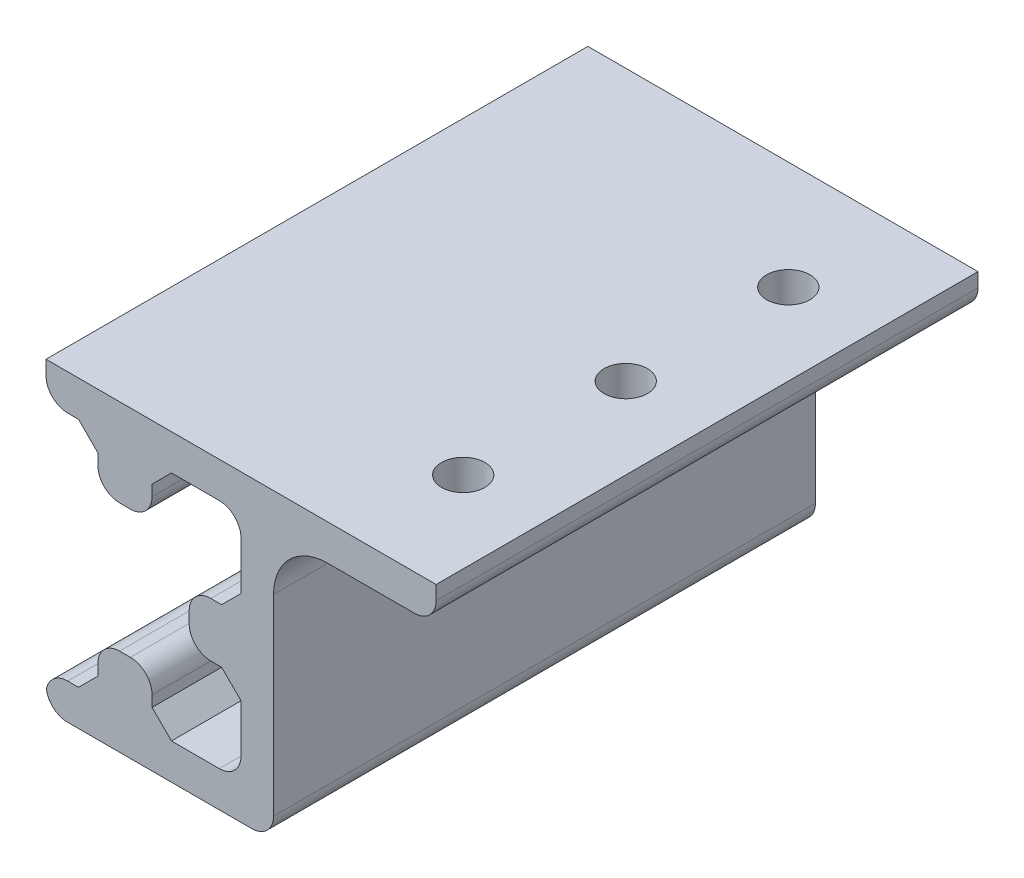
from build123d import *

# Parameters (mm, degrees)
BOSS_EXTRUDE1_DEPTH     = 50
CUT_EXTRUDE1_DEPTH      = 60.332090981
SKETCH3_W               = 15
SKETCH3_H               = 3.3
CUT_EXTRUDE2_DEPTH      = 60.332090981
CUT_EXTRUDE4_DEPTH      = 60.332090981
CUT_EXTRUDE4_DEPTH_BACK = 10
FILLET1_R               = 2
FILLET2_R               = 5
CUT_EXTRUDE5_DEPTH      = 60.332090981
CUT_EXTRUDE5_DEPTH_BACK = 60.332090981
SKETCH7_R               = 2
FILLET3_R               = 4


with BuildPart() as part:
    # Sketch1 → Boss-Extrude1 (new body)
    with BuildSketch(Plane.XY):
        Polygon((2.5, 7.92), (4.58, 10), (5.287106781, 10.707106781), (10.707106781, 10.707106781), (10.707106781, 5.287106781), (10, 4.58), (7.92, 2.5), (5.92, 2.5), (5.92, -2.5), (7.92, -2.5), (10, -4.58), (10.707106781, -5.287106781), (10.707106781, -7.287106781), (13.707106781, -7.287106781), (13.707106781, 10.707106781), (28.707106781, 10.707106781), (28.707106781, 14.007106781), (13.707106781, 14.007106781), (-7.287106781, 14.007106781), (-7.287106781, 10.707106781), (-5.287106781, 10.707106781), (-4.58, 10), (-2.5, 7.92), (-2.5, 5.92), (2.5, 5.92), align=None)
    boss_extrude1 = extrude(amount=BOSS_EXTRUDE1_DEPTH)

    # Sketch2 → Cut-Extrude1 (cut, through all)
    with BuildSketch(Plane.XY):
        Polygon((0, 0), (18.478629357, 0), (18.478629357, -9.938314006), (0, -9.42769987), align=None)
    extrude(amount=CUT_EXTRUDE1_DEPTH, mode=Mode.SUBTRACT)

    # Mirror1: Boss-Extrude1 across plane
    add(boss_extrude1.mirror(Plane.ZX))

    # Sketch3 → Cut-Extrude2 (cut, through all)
    with BuildSketch(Plane.XY):
        with Locations((21.207106781, -12.357106781)):
            Rectangle(SKETCH3_W, SKETCH3_H)
    extrude(amount=CUT_EXTRUDE2_DEPTH, mode=Mode.SUBTRACT)

    # Sketch6 → Cut-Extrude4 (cut, two sides: drawn at the far end of the back side and taken through both)
    with BuildSketch(Plane.XY.offset(-CUT_EXTRUDE4_DEPTH_BACK)):
        Polygon((-5.287106781, 10.707106781), (-4.287106781, 10.707106781), (-2.5, 8.92), (-2.5, 7.92), align=None)
        Polygon((2.5, 7.92), (2.5, 8.92), (4.287106781, 10.707106781), (5.287106781, 10.707106781), align=None)
        Polygon((7.92, 2.5), (8.92, 2.5), (10.707106781, 4.287106781), (10.707106781, 5.287106781), align=None)
        Polygon((7.92, -2.5), (10.707106781, -5.287106781), (10.707106781, -4.287106781), (8.92, -2.5), align=None)
        Polygon((2.5, -7.92), (5.287106781, -10.707106781), (4.287106781, -10.707106781), (2.5, -8.92), align=None)
        Polygon((-5.287106781, -10.707106781), (-2.5, -7.92), (-2.5, -8.92), (-4.287106781, -10.707106781), align=None)
    extrude(amount=CUT_EXTRUDE4_DEPTH + CUT_EXTRUDE4_DEPTH_BACK, mode=Mode.SUBTRACT)

    # Fillet1
    # the kernel refuses this fillet: 2 mm, written as the material it adds along each edge
    with BuildSketch(Plane(origin=(10.707106781, 10.707106781, 0), x_dir=(0, -1, 0), z_dir=(0, 0, 1)), Plane(origin=(10.707106781, -10.707106781, 0), x_dir=(-1, 0, 0), z_dir=(0, 0, 1))) as fillet1_piece_1:
        with BuildLine():
            CenterArc((FILLET1_R, -FILLET1_R), FILLET1_R, 90, 90)
            Line((0, -FILLET1_R), (0, 0))
            Line((0, 0), (FILLET1_R, 0))
        make_face()
    extrude(amount=50)
    # the kernel refuses this fillet: 2 mm, written as the material it takes off along each edge
    with BuildSketch(Plane(origin=(13.707106781, -14.007106781, -5), x_dir=(-1, 0, 0), z_dir=(0, 0, 1)), Plane(origin=(5.92, 2.5, -5), x_dir=(1, 0, 0), z_dir=(0, 0, 1)), Plane(origin=(2.5, 5.92, -5), x_dir=(-1, 0, 0), z_dir=(0, 0, 1)), Plane(origin=(-2.5, 5.92, -5), x_dir=(0, 1, 0), z_dir=(0, 0, 1)), Plane(origin=(-7.287106781, 10.707106781, -5), x_dir=(0, 1, 0), z_dir=(0, 0, 1)), Plane(origin=(28.707106781, 10.707106781, -5), x_dir=(-1, 0, 0), z_dir=(0, 0, 1)), Plane(origin=(5.92, -2.5, -5), x_dir=(0, 1, 0), z_dir=(0, 0, 1)), Plane(origin=(2.5, -5.92, -5), x_dir=(0, -1, 0), z_dir=(0, 0, 1)), Plane(origin=(-2.5, -5.92, -5), x_dir=(1, 0, 0), z_dir=(0, 0, 1)), Plane(origin=(-7.287106781, -10.707106781, -5), x_dir=(1, 0, 0), z_dir=(0, 0, 1)), Plane(origin=(-7.287106781, -14.007106781, -5), x_dir=(0, 1, 0), z_dir=(0, 0, 1))) as fillet1_2_piece_1:
        with BuildLine():
            CenterArc((FILLET1_R, -FILLET1_R), FILLET1_R, 90, 90)
            Line((0, -FILLET1_R), (0, 0))
            Line((0, 0), (FILLET1_R, 0))
        make_face()
    extrude(amount=60, mode=Mode.SUBTRACT)

    # Fillet2
    fillet2_edges = [part.edges().sort_by_distance(p)[0] for p in [
        (13.707106781, 10.707106781, 25),
    ]]
    fillet(fillet2_edges, radius=FILLET2_R)

    # Sketch7 → Cut-Extrude5 (cut, two sides: drawn at the far end of the back side and taken through both)
    with BuildSketch(Plane(origin=(0, 0, 0), x_dir=(1, 0, 0), z_dir=(0, 1, 0)).offset(-CUT_EXTRUDE5_DEPTH_BACK)):
        with Locations(Location((21.207106781, -40, 0), (0, 0, 270))):
            Circle(SKETCH7_R)
        with Locations(Location((21.207106781, -25, 0), (0, 0, 270))):
            Circle(SKETCH7_R)
        with Locations(Location((21.207106781, -10, 0), (0, 0, 270))):
            Circle(SKETCH7_R)
    extrude(amount=CUT_EXTRUDE5_DEPTH + CUT_EXTRUDE5_DEPTH_BACK, mode=Mode.SUBTRACT)

    # Fillet3
    # the kernel refuses this fillet: 4 mm, written as the material it takes off along each edge
    with BuildSketch(Plane(origin=(-10.5, -5.92, 0), x_dir=(0, -1, 0), z_dir=(1, 0, 0))) as fillet3_piece_1_section:
        with BuildLine():
            CenterArc((FILLET3_R, -FILLET3_R), FILLET3_R, 90, 90)
            Line((0, -FILLET3_R), (0, 0))
            Line((0, 0), (FILLET3_R, 0))
        make_face()
    fillet3_piece_1 = extrude(amount=21, mode=Mode.PRIVATE)
    fillet3_piece_1 = split(fillet3_piece_1, bisect_by=Plane(origin=(2.5, -6.766631822, 0.880672942), z_dir=(-1, 0, 0)), keep=Keep.TOP, mode=Mode.PRIVATE)
    add(fillet3_piece_1, mode=Mode.SUBTRACT)
    with BuildSketch(Plane(origin=(-10.5, -5.92, 0), x_dir=(0, -1, 0), z_dir=(1, 0, 0))) as fillet3_piece_2_section:
        with BuildLine():
            CenterArc((FILLET3_R, -FILLET3_R), FILLET3_R, 90, 90)
            Line((0, -FILLET3_R), (0, 0))
            Line((0, 0), (FILLET3_R, 0))
        make_face()
    fillet3_piece_2 = extrude(amount=21, mode=Mode.PRIVATE)
    fillet3_piece_2 = split(fillet3_piece_2, bisect_by=Plane(origin=(2.799453379, -9.219453379, 0.025268376), z_dir=(-0.7071067811865467, -0.7071067811865485, 0)), keep=Keep.TOP, mode=Mode.PRIVATE)
    add(fillet3_piece_2, mode=Mode.SUBTRACT)
    with BuildSketch(Plane(origin=(5.92, -10.5, 0), x_dir=(1, 0, 0), z_dir=(0, 1, 0))) as fillet3_piece_3_section:
        with BuildLine():
            CenterArc((FILLET3_R, -FILLET3_R), FILLET3_R, 90, 90)
            Line((0, -FILLET3_R), (0, 0))
            Line((0, 0), (FILLET3_R, 0))
        make_face()
    fillet3_piece_3 = extrude(amount=21, mode=Mode.PRIVATE)
    fillet3_piece_3 = split(fillet3_piece_3, bisect_by=Plane(origin=(6.766631909, -2.5, 0.880672877), z_dir=(0, 1, 0)), keep=Keep.TOP, mode=Mode.PRIVATE)
    fillet3_piece_3 = split(fillet3_piece_3, bisect_by=Plane(origin=(6.766631909, 2.5, 0.880672877), z_dir=(0, -1, 0)), keep=Keep.TOP, mode=Mode.PRIVATE)
    add(fillet3_piece_3, mode=Mode.SUBTRACT)
    with BuildSketch(Plane(origin=(5.92, -10.5, 0), x_dir=(1, 0, 0), z_dir=(0, 1, 0))) as fillet3_piece_4_section:
        with BuildLine():
            CenterArc((FILLET3_R, -FILLET3_R), FILLET3_R, 90, 90)
            Line((0, -FILLET3_R), (0, 0))
            Line((0, 0), (FILLET3_R, 0))
        make_face()
    fillet3_piece_4 = extrude(amount=21, mode=Mode.PRIVATE)
    fillet3_piece_4 = split(fillet3_piece_4, bisect_by=Plane(origin=(9.219453379, -2.799453379, 0.025268376), z_dir=(0.7071067811865552, 0.7071067811865398, 0)), keep=Keep.TOP, mode=Mode.PRIVATE)
    fillet3_piece_4 = split(fillet3_piece_4, bisect_by=Plane(origin=(6.519817793, 0.099817793, 0.025268376), z_dir=(0.7071067811865552, -0.7071067811865398, 0)), keep=Keep.TOP, mode=Mode.PRIVATE)
    add(fillet3_piece_4, mode=Mode.SUBTRACT)
    with BuildSketch(Plane(origin=(-10.5, 5.92, 0), x_dir=(0, 1, 0), z_dir=(1, 0, 0))) as fillet3_piece_5_section:
        with BuildLine():
            CenterArc((FILLET3_R, FILLET3_R), FILLET3_R, 180, 90)
            Line((0, FILLET3_R), (0, 0))
            Line((0, 0), (FILLET3_R, 0))
        make_face()
    fillet3_piece_5 = extrude(amount=21, mode=Mode.PRIVATE)
    fillet3_piece_5 = split(fillet3_piece_5, bisect_by=Plane(origin=(2.5, 6.766633177, 0.880671903), z_dir=(-1, 0, 0)), keep=Keep.TOP, mode=Mode.PRIVATE)
    add(fillet3_piece_5, mode=Mode.SUBTRACT)
    with BuildSketch(Plane(origin=(-10.5, 5.92, 0), x_dir=(0, 1, 0), z_dir=(1, 0, 0))) as fillet3_piece_6_section:
        with BuildLine():
            CenterArc((FILLET3_R, FILLET3_R), FILLET3_R, 180, 90)
            Line((0, FILLET3_R), (0, 0))
            Line((0, 0), (FILLET3_R, 0))
        make_face()
    fillet3_piece_6 = extrude(amount=21, mode=Mode.PRIVATE)
    fillet3_piece_6 = split(fillet3_piece_6, bisect_by=Plane(origin=(2.799453379, 9.219453379, 0.025268376), z_dir=(-0.7071067811865467, 0.7071067811865485, 0)), keep=Keep.TOP, mode=Mode.PRIVATE)
    add(fillet3_piece_6, mode=Mode.SUBTRACT)


solid = part.part
